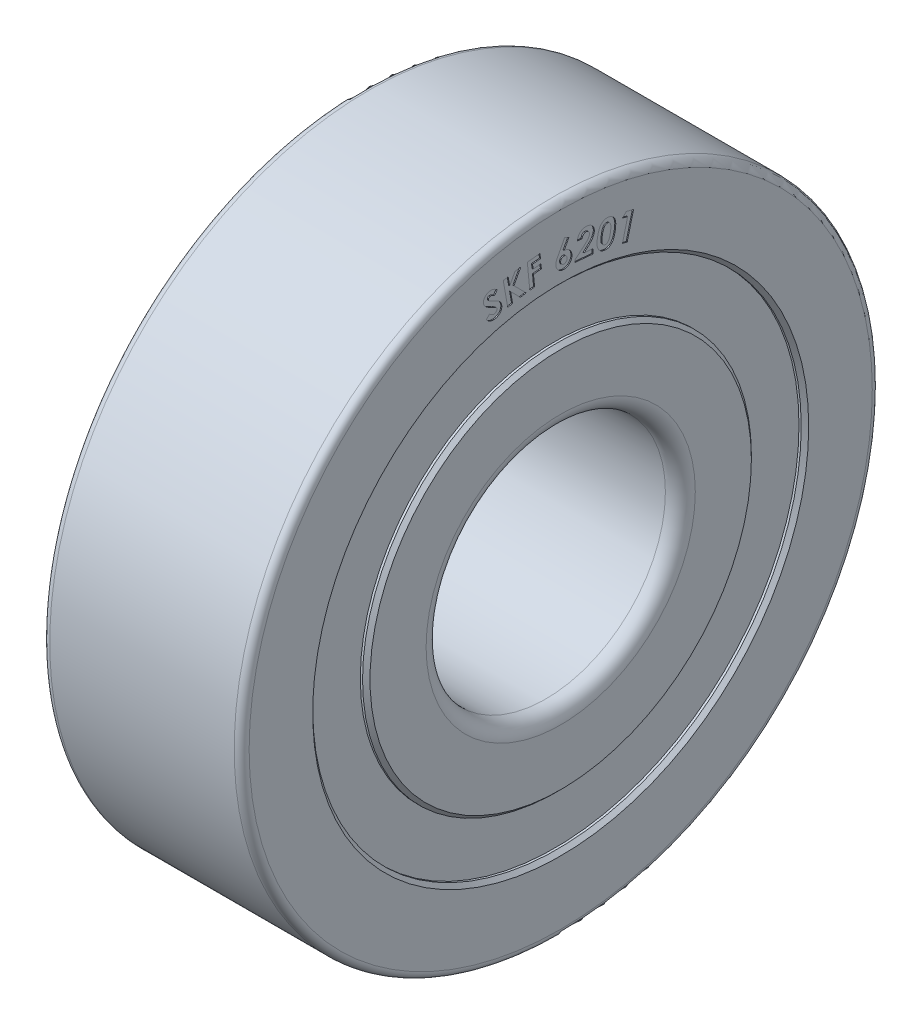
from build123d import *

# Parameters (mm, degrees)
CIRPATTERN1_COUNT = 8
WRAP1_START       = -0.05
WRAP1_DEPTH       = 0.05
SEAL_START        = 0.2
SKETCH5_R         = 12.25
SKETCH5_R_2       = 9.75
SEAL_1_DEPTH      = 0.2
SKETCH6_R         = 12.25
SKETCH6_R_2       = 9.75
SEAL_2_DEPTH      = 0.2


# Read off the part's stored shape, not the designer's step: Wrap1
with BuildPart() as part:
    # Sketch1 → Revolve1 (revolve)
    with BuildSketch(Plane.XY, mode=Mode.PRIVATE) as revolve1_sk:
        with BuildLine():
            Line((-9.8125, 9.75), (-7.165063509, 9.75))
            ThreePointArc((-7.165063509, 9.75), (-5, 8.5), (-2.834936491, 9.75))
            Line((-2.834936491, 9.75), (-0.1875, 9.75))
            Line((-0.1875, 9.75), (0, 9.5625))
            Line((0, 9.5625), (0, 6.75))
            ThreePointArc((0, 6.75), (-0.219669914, 6.219669914), (-0.75, 6))
            Line((-0.75, 6), (-9.25, 6))
            ThreePointArc((-9.25, 6), (-9.780330086, 6.219669914), (-10, 6.75))
            Line((-10, 6.75), (-10, 9.5625))
            Line((-10, 9.5625), (-9.8125, 9.75))
        make_face()
        with BuildLine():
            Line((-0.375, 16), (-9.625, 16))
            ThreePointArc((-9.625, 16), (-9.890165043, 15.890165043), (-10, 15.625))
            Line((-10, 15.625), (-10, 12.4375))
            Line((-10, 12.4375), (-9.8125, 12.25))
            Line((-9.8125, 12.25), (-7.165063509, 12.25))
            ThreePointArc((-7.165063509, 12.25), (-5, 13.5), (-2.834936491, 12.25))
            Line((-2.834936491, 12.25), (-0.1875, 12.25))
            Line((-0.1875, 12.25), (0, 12.4375))
            Line((0, 12.4375), (0, 15.625))
            ThreePointArc((0, 15.625), (-0.109834957, 15.890165043), (-0.375, 16))
        make_face()
    revolve(revolve1_sk.sketch.rotate(Axis((0, 0, 0), (-1, 0, 0)), 90), axis=Axis((0, 0, 0), (-1, 0, 0)))

    # Wrap1 outline → Wrap1 (cut)
    # profile 1 of 7: a face of its own
    with BuildSketch(Plane(origin=(0, 0, 0), x_dir=(0, 0, -1), z_dir=(1, 0, 0)).offset(WRAP1_START)):
        with BuildLine():
            add(Edge.make_bspline(
                [(2.737499951, 13.363276432), (2.733807226, 13.342852117), (2.7266215, 13.303108156), (2.71403937, 13.24554571), (2.700756131, 13.191683325), (2.685766048, 13.141789388), (2.670033097, 13.095556918), (2.652870722, 13.053145801), (2.634731994, 13.014472644), (2.615314136, 12.979556708), (2.594884118, 12.947916705), (2.573688946, 12.918935063), (2.552018473, 12.892188091), (2.528875899, 12.868579224), (2.5054133, 12.846955029), (2.481060944, 12.82799697), (2.455771096, 12.811643157), (2.429681485, 12.797886337), (2.402695227, 12.786155959), (2.374333105, 12.777487982), (2.345048041, 12.770563132), (2.314426594, 12.766554791), (2.282760862, 12.764405239), (2.249779656, 12.764767461), (2.215662951, 12.767294156), (2.192688918, 12.770843798), (2.180989534, 12.772651432)],
                knots=[0, 0, 0, 0, 0.067545985, 0.131438683, 0.191737407, 0.24805044, 0.300942885, 0.350625504, 0.396879519, 0.439879255, 0.480551384, 0.519373001, 0.556704184, 0.592468396, 0.626866328, 0.660490989, 0.692777508, 0.724752265, 0.756395798, 0.788384281, 0.821143235, 0.854225866, 0.888767365, 0.924366041, 0.961483874, 1, 1, 1, 1], degree=3))
            add(Edge.make_bspline(
                [(2.401822867, 14.106766015), (2.413140592, 14.104664027), (2.435517117, 14.100508139), (2.468014274, 14.091680855), (2.498782513, 14.08056972), (2.528172598, 14.068206349), (2.555899783, 14.053466776), (2.582157118, 14.036905537), (2.606737594, 14.018269945), (2.62981473, 13.997900292), (2.651131433, 13.975487993), (2.670804594, 13.95115389), (2.688536939, 13.924729428), (2.704452046, 13.896240433), (2.718449353, 13.865728371), (2.730749409, 13.833284075), (2.741105332, 13.798812129), (2.749809849, 13.762144315), (2.756206103, 13.72289735), (2.76077459, 13.68074346), (2.762286021, 13.635511443), (2.762084944, 13.587117471), (2.759402298, 13.535592916), (2.75427507, 13.480901048), (2.747443663, 13.423005152), (2.740877592, 13.383564851), (2.737499951, 13.363276432)],
                knots=[0, 0, 0, 0, 0.037292116, 0.073731071, 0.108963354, 0.143239421, 0.176961598, 0.21059567, 0.24373203, 0.276809835, 0.310235061, 0.343842068, 0.378091577, 0.413227158, 0.449474523, 0.486776185, 0.525574058, 0.566034139, 0.608809913, 0.654349649, 0.703334005, 0.755373739, 0.811140495, 0.870453047, 0.933359971, 1, 1, 1, 1], degree=3))
            add(Edge.make_bspline(
                [(2.038541617, 13.991401432), (2.051031324, 14.003350348), (2.075528547, 14.026786868), (2.116332601, 14.056004448), (2.158844885, 14.079785843), (2.203767876, 14.097118498), (2.250601106, 14.10857314), (2.299387367, 14.114291349), (2.350227913, 14.11414614), (2.384325847, 14.109268783), (2.401822867, 14.106766015)],
                knots=[0, 0, 0, 0, 0.130283265, 0.255536684, 0.377492833, 0.496937855, 0.617670735, 0.740347648, 0.866761943, 1, 1, 1, 1], degree=3))
            add(Edge.make_bspline(
                [(1.844270784, 13.503380599), (1.849374993, 13.531476455), (1.859218274, 13.585658297), (1.877959244, 13.66318627), (1.898121045, 13.734390857), (1.921291508, 13.79885056), (1.946684803, 13.8567636), (1.974637701, 13.907915468), (2.004199407, 13.953259349), (2.027363155, 13.978986103), (2.038541617, 13.991401432)],
                knots=[0, 0, 0, 0, 0.160881333, 0.310253829, 0.4492719, 0.577697131, 0.695952237, 0.805182789, 0.905984266, 1, 1, 1, 1], degree=3))
            add(Edge.make_bspline(
                [(2.180989534, 12.772651432), (2.169322819, 12.774838501), (2.14643497, 12.779129109), (2.113235778, 12.788134725), (2.081756779, 12.798643391), (2.052133652, 12.811311837), (2.024128155, 12.82550567), (1.998149886, 12.842041018), (1.973759648, 12.860015493), (1.951181286, 12.879882437), (1.930640585, 12.901932491), (1.91154269, 12.925613728), (1.894275762, 12.951355318), (1.878722092, 12.979005825), (1.864543023, 13.008516524), (1.852364105, 13.040064285), (1.842058411, 13.073521579), (1.832938308, 13.108993255), (1.826319414, 13.147219064), (1.82154004, 13.188419274), (1.819634097, 13.232963092), (1.820057726, 13.280747409), (1.822258321, 13.331855131), (1.827543595, 13.386100896), (1.834338661, 13.443736419), (1.840892271, 13.48309202), (1.844270784, 13.503380599)],
                knots=[0, 0, 0, 0, 0.038897413, 0.076309234, 0.112663958, 0.147600025, 0.181834877, 0.215467196, 0.24841971, 0.281078495, 0.313891878, 0.347089213, 0.380710697, 0.415371017, 0.451009272, 0.487947335, 0.526108121, 0.565723357, 0.607922782, 0.653174118, 0.701602887, 0.753962738, 0.809795306, 0.869230254, 0.932585652, 1, 1, 1, 1], degree=3))
        make_face()
        with BuildLine():
            add(Edge.make_bspline(
                [(2.084895784, 13.456766015), (2.081679204, 13.437433475), (2.075507334, 13.400338824), (2.069466538, 13.346607883), (2.065192946, 13.297378563), (2.064241313, 13.252422285), (2.065309572, 13.211708172), (2.06904795, 13.175274496), (2.075415994, 13.143114292), (2.084556355, 13.115174012), (2.096014628, 13.090891381), (2.10876045, 13.069378384), (2.123031841, 13.050428936), (2.13921613, 13.034416627), (2.156505557, 13.020673961), (2.175800795, 13.010215266), (2.196365939, 13.001869187), (2.211045191, 12.99889787), (2.218489534, 12.997391015)],
                knots=[0, 0, 0, 0, 0.110591194, 0.212198802, 0.305086177, 0.389376411, 0.465844276, 0.534826629, 0.595839759, 0.65052975, 0.700283282, 0.747083496, 0.791472616, 0.833737165, 0.875288639, 0.9156415, 0.957218961, 1, 1, 1, 1], degree=3))
            add(Edge.make_bspline(
                [(2.368749951, 13.876297265), (2.358693215, 13.877548717), (2.338923923, 13.88000879), (2.309192234, 13.877046211), (2.280324268, 13.86948998), (2.252265725, 13.856244757), (2.225336819, 13.836451621), (2.200440129, 13.808936509), (2.177908075, 13.773693846), (2.160158672, 13.73956586), (2.147209997, 13.707926157), (2.137254262, 13.680667824), (2.12763181, 13.650537791), (2.118727201, 13.617344266), (2.109403501, 13.581403146), (2.101055305, 13.542424967), (2.092596532, 13.500603182), (2.087520789, 13.471709083), (2.084895784, 13.456766015)],
                knots=[0, 0, 0, 0, 0.053786025, 0.105731283, 0.157836518, 0.211978457, 0.269819371, 0.334549736, 0.408221736, 0.491898867, 0.538912158, 0.590062543, 0.646309757, 0.707165765, 0.772934551, 0.843885536, 0.919262791, 1, 1, 1, 1], degree=3))
            add(Edge.make_bspline(
                [(2.496093701, 13.401818099), (2.499358181, 13.421849337), (2.505632803, 13.460351158), (2.512430928, 13.516034465), (2.516605471, 13.56720689), (2.518714514, 13.613866076), (2.517766153, 13.656074801), (2.514150545, 13.693662532), (2.508558552, 13.726859944), (2.499449007, 13.755536848), (2.488673967, 13.780739372), (2.476238882, 13.802808369), (2.462329401, 13.822279351), (2.446567644, 13.838637363), (2.429675962, 13.852786584), (2.410729239, 13.863507647), (2.390428505, 13.8717621), (2.376017025, 13.874776989), (2.368749951, 13.876297265)],
                knots=[0, 0, 0, 0, 0.111988795, 0.215252417, 0.309452219, 0.395261949, 0.472886488, 0.542190287, 0.60354385, 0.658237954, 0.707801833, 0.754561923, 0.797774535, 0.839449086, 0.879623806, 0.918897425, 0.959103546, 1, 1, 1, 1], degree=3))
            add(Edge.make_bspline(
                [(2.373177034, 13.060411849), (2.379873377, 13.068961755), (2.393947134, 13.086931159), (2.41227738, 13.118035424), (2.42930626, 13.153744546), (2.445157508, 13.19416969), (2.459976983, 13.23927911), (2.473324388, 13.289220782), (2.48560021, 13.343878828), (2.492504075, 13.381998165), (2.496093701, 13.401818099)],
                knots=[0, 0, 0, 0, 0.088795564, 0.186622326, 0.294646792, 0.412312407, 0.541704089, 0.683007715, 0.835181655, 1, 1, 1, 1], degree=3))
            add(Edge.make_bspline(
                [(2.218489534, 12.997391015), (2.225678742, 12.996414289), (2.239845163, 12.994489638), (2.261105847, 12.995011799), (2.281692967, 12.998767349), (2.301484053, 13.005289948), (2.320672378, 13.014645323), (2.339184487, 13.026934603), (2.35688135, 13.042405242), (2.36765254, 13.054307324), (2.373177034, 13.060411849)],
                knots=[0, 0, 0, 0, 0.123905972, 0.244158222, 0.361771315, 0.480512058, 0.599326979, 0.725697231, 0.859311352, 1, 1, 1, 1], degree=3))
        make_face(mode=Mode.SUBTRACT)
    # profile 2 of 7: a face of its own
    with BuildSketch(Plane(origin=(0, 0, 0), x_dir=(0, 0, -1), z_dir=(1, 0, 0)).offset(WRAP1_START)):
        with BuildLine():
            add(Edge.make_bspline(
                [(0.830735623, 13.851886561), (0.833432158, 13.86877561), (0.83869881, 13.901761922), (0.850709988, 13.949359484), (0.866156135, 13.993835878), (0.884529663, 14.035323297), (0.906235233, 14.073695236), (0.931449111, 14.108809808), (0.959803422, 14.140940657), (0.99146337, 14.169579516), (1.025472121, 14.194807508), (1.061586696, 14.216299856), (1.099555405, 14.233823542), (1.139238282, 14.247443729), (1.18080972, 14.256830229), (1.224063058, 14.262184308), (1.269222604, 14.263881306), (1.299753675, 14.261803549), (1.31537104, 14.260740727)],
                knots=[0, 0, 0, 0, 0.072277081, 0.141165699, 0.207200771, 0.271101887, 0.332731944, 0.393222883, 0.453533229, 0.513542499, 0.573359591, 0.632266994, 0.690883348, 0.749836455, 0.809303571, 0.870705961, 0.933863042, 1, 1, 1, 1], degree=3))
            Line((0.830735623, 13.851886561), (1.070579373, 13.830011561))
            add(Edge.make_bspline(
                [(1.27865229, 14.031834477), (1.272144447, 14.032221094), (1.259384441, 14.032979139), (1.240422759, 14.031945124), (1.222183745, 14.028793832), (1.204573643, 14.023768173), (1.187533329, 14.017079752), (1.171329401, 14.008017023), (1.155675305, 13.997362315), (1.140785188, 13.984850037), (1.127121854, 13.970525255), (1.114457251, 13.954885936), (1.10356845, 13.93761777), (1.094135487, 13.918931123), (1.086082937, 13.898791378), (1.079316141, 13.877216472), (1.074101456, 13.854121286), (1.07177409, 13.838189758), (1.070579373, 13.830011561)],
                knots=[0, 0, 0, 0, 0.060424494, 0.118475035, 0.175648187, 0.231711076, 0.288067957, 0.344991196, 0.403492114, 0.463480674, 0.524968313, 0.586823735, 0.649800494, 0.713884028, 0.780705219, 0.850723117, 0.923371087, 1, 1, 1, 1], degree=3))
            add(Edge.make_bspline(
                [(1.44037104, 13.843553227), (1.440940997, 13.855550988), (1.442048807, 13.878870735), (1.435593818, 13.913020701), (1.422292095, 13.944267852), (1.402864658, 13.972145952), (1.378410133, 13.996128285), (1.348894859, 14.014202906), (1.315301823, 14.026907006), (1.291176167, 14.030150662), (1.27865229, 14.031834477)],
                knots=[0, 0, 0, 0, 0.129257312, 0.251234202, 0.371268153, 0.493119118, 0.615659282, 0.7380741, 0.864031558, 1, 1, 1, 1], degree=3))
            add(Edge.make_bspline(
                [(1.163548123, 13.468032394), (1.176296035, 13.478798498), (1.200925216, 13.499598793), (1.235379273, 13.531085375), (1.267360906, 13.560285988), (1.295725202, 13.588388508), (1.320744882, 13.615114624), (1.343087218, 13.639909446), (1.361741805, 13.663636568), (1.382317032, 13.692245745), (1.402878227, 13.726566126), (1.421816228, 13.766735548), (1.435153676, 13.805403302), (1.438673659, 13.831141797), (1.44037104, 13.843553227)],
                knots=[0, 0, 0, 0, 0.104805719, 0.202486416, 0.293164386, 0.376836358, 0.453216447, 0.523135377, 0.586410623, 0.642700171, 0.744446816, 0.837146783, 0.921470102, 1, 1, 1, 1], degree=3))
            Line((1.163548123, 13.468032394), (0.726568957, 13.096417811))
            Line((0.726568957, 13.096417811), (0.715891873, 12.978709477))
            Line((0.715891873, 12.978709477), (1.61146479, 12.897459477))
            Line((1.61146479, 12.897459477), (1.632298123, 13.125063644))
            Line((1.632298123, 13.125063644), (1.17162104, 13.166990727))
            Line((1.17162104, 13.166990727), (1.330475207, 13.306574061))
            add(Edge.make_bspline(
                [(1.68646479, 13.840428227), (1.685383952, 13.830773238), (1.683190954, 13.811183457), (1.677336533, 13.781787991), (1.669497501, 13.752051626), (1.659583438, 13.721922959), (1.647205753, 13.691615186), (1.633190875, 13.660649331), (1.616656727, 13.629596603), (1.598375277, 13.597700399), (1.577147956, 13.565151811), (1.552184986, 13.531893066), (1.524026898, 13.497165524), (1.492153567, 13.461267421), (1.456782638, 13.42411253), (1.417822156, 13.385876564), (1.375719932, 13.346162332), (1.345840787, 13.320018651), (1.330475207, 13.306574061)],
                knots=[0, 0, 0, 0, 0.044322816, 0.089930112, 0.136630675, 0.184612579, 0.234564071, 0.285974149, 0.339667434, 0.395047136, 0.453723857, 0.516873516, 0.58474752, 0.657719536, 0.73590087, 0.818821739, 0.906827682, 1, 1, 1, 1], degree=3))
            add(Edge.make_bspline(
                [(1.31537104, 14.260740727), (1.334369722, 14.258402659), (1.371480977, 14.253835572), (1.42479907, 14.239715674), (1.473916081, 14.219181303), (1.518997371, 14.193093309), (1.559526074, 14.161417243), (1.595392531, 14.124682089), (1.625783331, 14.082455249), (1.650656562, 14.036039894), (1.66966029, 13.987353834), (1.682816278, 13.938238103), (1.688913479, 13.88908168), (1.687277747, 13.856581024), (1.68646479, 13.840428227)],
                knots=[0, 0, 0, 0, 0.091940725, 0.179593287, 0.264139606, 0.347159484, 0.429211051, 0.510655585, 0.593119915, 0.678441152, 0.763135621, 0.843800373, 0.922368925, 1, 1, 1, 1], degree=3))
        make_face()
    # profile 3 of 7: a face of its own
    with BuildSketch(Plane(origin=(0, 0, 0), x_dir=(0, 0, -1), z_dir=(1, 0, 0)).offset(WRAP1_START)):
        with BuildLine():
            add(Edge.make_bspline(
                [(0.173468268, 13.770517026), (0.186947038, 13.770012521), (0.213428443, 13.769021331), (0.25232208, 13.762793717), (0.289620721, 13.753289262), (0.325359617, 13.739802548), (0.359539414, 13.722907717), (0.392130884, 13.702153727), (0.422785051, 13.677463569), (0.451899581, 13.649831608), (0.478130242, 13.619254234), (0.501640752, 13.586991439), (0.520875217, 13.55251183), (0.536951774, 13.516600028), (0.548855496, 13.47871113), (0.557496989, 13.439250824), (0.562559771, 13.397907938), (0.562885668, 13.369749775), (0.563051601, 13.35541286)],
                knots=[0, 0, 0, 0, 0.063712171, 0.125173721, 0.185786933, 0.245390216, 0.305400352, 0.365733716, 0.4276416, 0.491204266, 0.555209138, 0.617843092, 0.679583468, 0.741498151, 0.80353103, 0.866957115, 0.932260329, 1, 1, 1, 1], degree=3))
            Line((0.173468268, 13.770517026), (0.404718268, 14.207496193))
            Line((0.404718268, 14.207496193), (0.196905768, 14.31478786))
            Line((0.196905768, 14.31478786), (-0.143198399, 13.668173276))
            add(Edge.make_bspline(
                [(-0.248146316, 13.362704526), (-0.247768073, 13.372697275), (-0.247009313, 13.392742875), (-0.243259496, 13.422865854), (-0.237322575, 13.452996331), (-0.230208902, 13.478352996), (-0.223002473, 13.499733866), (-0.215902449, 13.517828983), (-0.207554303, 13.538004414), (-0.197605883, 13.560124944), (-0.186138331, 13.584344667), (-0.173110091, 13.610516636), (-0.158775675, 13.63876961), (-0.148524426, 13.658119868), (-0.143198399, 13.668173276)],
                knots=[0, 0, 0, 0, 0.091871355, 0.184295283, 0.278641223, 0.373873502, 0.426097173, 0.485953161, 0.552477122, 0.626757907, 0.708837919, 0.798748528, 0.895439984, 1, 1, 1, 1], degree=3))
            add(Edge.make_bspline(
                [(0.154718268, 12.95697536), (0.140457516, 12.95746398), (0.112321028, 12.958428028), (0.071174508, 12.964901612), (0.031838733, 12.974641878), (-0.005491297, 12.988657718), (-0.04094757, 13.006348542), (-0.074479371, 13.027922196), (-0.106223821, 13.05305327), (-0.135482189, 13.081786206), (-0.162218678, 13.112760612), (-0.185292373, 13.145448088), (-0.205489094, 13.178818797), (-0.221241519, 13.213604246), (-0.23374624, 13.249306454), (-0.242141114, 13.286178572), (-0.247731896, 13.324076833), (-0.248007334, 13.349750104), (-0.248146316, 13.362704526)],
                knots=[0, 0, 0, 0, 0.06734365, 0.132869139, 0.196314253, 0.258459609, 0.320803476, 0.383131162, 0.446460908, 0.511699705, 0.576540449, 0.639456057, 0.700491865, 0.760485912, 0.819483933, 0.878858307, 0.938873366, 1, 1, 1, 1], degree=3))
            add(Edge.make_bspline(
                [(0.563051601, 13.35541286), (0.562535737, 13.341590464), (0.561521903, 13.314425143), (0.555462, 13.274514485), (0.545406987, 13.236394629), (0.532233373, 13.199614539), (0.514865109, 13.164741419), (0.494189314, 13.131307061), (0.469579855, 13.099782935), (0.441576869, 13.070328124), (0.411150534, 13.043502113), (0.378986413, 13.019813298), (0.345262072, 13.000025765), (0.310140778, 12.983543065), (0.273238881, 12.971540068), (0.235043749, 12.962471262), (0.195303743, 12.95750483), (0.16835956, 12.957153321), (0.154718268, 12.95697536)],
                knots=[0, 0, 0, 0, 0.065324149, 0.128382331, 0.190264872, 0.251382752, 0.31265323, 0.374003292, 0.436853007, 0.501266752, 0.565784895, 0.628301772, 0.689716249, 0.75027965, 0.811244551, 0.872734322, 0.935567973, 1, 1, 1, 1], degree=3))
        make_face()
        with BuildLine():
            add(Edge.make_bspline(
                [(-0.007260899, 13.366089943), (-0.006876546, 13.354050164), (-0.006126977, 13.3305701), (0.003144181, 13.296866168), (0.018200648, 13.266075987), (0.039006202, 13.238924092), (0.063866269, 13.216502718), (0.091577609, 13.19981003), (0.121630881, 13.189429993), (0.142572492, 13.187937802), (0.153155768, 13.187183693)],
                knots=[0, 0, 0, 0, 0.135186379, 0.263641458, 0.389922987, 0.518897229, 0.646206449, 0.764506131, 0.880988305, 1, 1, 1, 1], degree=3))
            add(Edge.make_bspline(
                [(0.156801601, 13.537964943), (0.145703638, 13.537609195), (0.124050264, 13.536915089), (0.093120765, 13.527188518), (0.064882305, 13.511825464), (0.040079774, 13.490434732), (0.019459521, 13.4643606), (0.004105738, 13.434519072), (-0.005238525, 13.401270392), (-0.006573779, 13.378042815), (-0.007260899, 13.366089943)],
                knots=[0, 0, 0, 0, 0.125199432, 0.244278191, 0.363027997, 0.487107669, 0.61235338, 0.737181965, 0.864754278, 1, 1, 1, 1], degree=3))
            add(Edge.make_bspline(
                [(0.322166184, 13.361923276), (0.321726626, 13.373947677), (0.320874075, 13.397269788), (0.312483928, 13.430915557), (0.297219106, 13.46106719), (0.276584066, 13.487528791), (0.251777339, 13.509916902), (0.222820029, 13.525967311), (0.190791567, 13.536085152), (0.168336358, 13.537327021), (0.156801601, 13.537964943)],
                knots=[0, 0, 0, 0, 0.133531098, 0.258992296, 0.381998195, 0.506509268, 0.63025499, 0.750801937, 0.871992319, 1, 1, 1, 1], degree=3))
            add(Edge.make_bspline(
                [(0.153155768, 13.187183693), (0.164238792, 13.187695742), (0.185998399, 13.188701063), (0.217518661, 13.197860797), (0.246384663, 13.213674136), (0.272261964, 13.235273054), (0.294058044, 13.261607952), (0.310385244, 13.291974897), (0.320246306, 13.325907698), (0.321514857, 13.349704832), (0.322166184, 13.361923276)],
                knots=[0, 0, 0, 0, 0.122637376, 0.24077734, 0.360016813, 0.485042179, 0.612163467, 0.736550565, 0.864734041, 1, 1, 1, 1], degree=3))
        make_face(mode=Mode.SUBTRACT)
    # profile 4 of 7: a face of its own
    with BuildSketch(Plane(origin=(0, 0, 0), x_dir=(0, 0, -1), z_dir=(1, 0, 0)).offset(WRAP1_START)):
        with BuildLine():
            add(Edge.make_bspline(
                [(-3.321157352, 13.551873315), (-3.331450009, 13.560198687), (-3.351181298, 13.57615864), (-3.38162082, 13.596549774), (-3.41089479, 13.613217941), (-3.439527565, 13.62529098), (-3.467104851, 13.633577042), (-3.493805887, 13.637992172), (-3.519816334, 13.63785699), (-3.536382717, 13.634518048), (-3.544594852, 13.632862898)],
                knots=[0, 0, 0, 0, 0.160969074, 0.308581882, 0.44520165, 0.570135247, 0.685746178, 0.79477476, 0.898267633, 1, 1, 1, 1], degree=3))
            Line((-3.321157352, 13.551873315), (-3.184699019, 13.753956648))
            add(Edge.make_bspline(
                [(-3.600324019, 13.862550398), (-3.584678156, 13.866068926), (-3.553556646, 13.873067702), (-3.505728135, 13.876557193), (-3.457753347, 13.874107813), (-3.417649354, 13.867429895), (-3.385076626, 13.858720018), (-3.359396802, 13.850170582), (-3.332706706, 13.839276114), (-3.304851559, 13.826682724), (-3.276309413, 13.811315491), (-3.246451535, 13.794473186), (-3.215789235, 13.77512317), (-3.195246902, 13.76113775), (-3.184699019, 13.753956648)],
                knots=[0, 0, 0, 0, 0.108047546, 0.214919614, 0.322191863, 0.431438326, 0.488386557, 0.549484368, 0.613847185, 0.682749942, 0.755556858, 0.832388639, 0.913936501, 1, 1, 1, 1], degree=3))
            add(Edge.make_bspline(
                [(-3.863344852, 13.455519148), (-3.86583411, 13.466328725), (-3.870734827, 13.487610041), (-3.874001735, 13.519930609), (-3.874175587, 13.551896643), (-3.870308554, 13.583459197), (-3.863673609, 13.614789553), (-3.85295031, 13.645536732), (-3.839529318, 13.676218068), (-3.82224258, 13.705888327), (-3.802571998, 13.734276625), (-3.780176338, 13.760225122), (-3.7558373, 13.783829997), (-3.729289239, 13.805080468), (-3.700098292, 13.823216311), (-3.668993928, 13.839249361), (-3.635586939, 13.85260127), (-3.612197009, 13.859200537), (-3.600324019, 13.862550398)],
                knots=[0, 0, 0, 0, 0.061637042, 0.121347718, 0.180244897, 0.239049011, 0.297853125, 0.358003242, 0.419813973, 0.483825244, 0.548646954, 0.611639763, 0.674118049, 0.736997913, 0.800350426, 0.864907332, 0.931425451, 1, 1, 1, 1], degree=3))
            add(Edge.make_bspline(
                [(-3.424803186, 13.099529565), (-3.444733022, 13.108710603), (-3.482963776, 13.126322289), (-3.537164889, 13.153369231), (-3.586480588, 13.178658902), (-3.630486031, 13.203255791), (-3.669567329, 13.226165485), (-3.703284756, 13.248179707), (-3.732145602, 13.26852263), (-3.756048009, 13.288431745), (-3.776432255, 13.308070335), (-3.794543987, 13.327701776), (-3.810888478, 13.347778469), (-3.824840261, 13.368529241), (-3.837596876, 13.389398556), (-3.8481826, 13.410936079), (-3.856940695, 13.432965922), (-3.861213339, 13.448012695), (-3.863344852, 13.455519148)],
                knots=[0, 0, 0, 0, 0.112775619, 0.216333786, 0.311321554, 0.397602949, 0.475421926, 0.544104326, 0.604528439, 0.656798734, 0.703816074, 0.7499163, 0.794023829, 0.836718668, 0.878344049, 0.91964777, 0.959914311, 1, 1, 1, 1], degree=3))
            add(Edge.make_bspline(
                [(-3.197980269, 12.927394148), (-3.20024207, 12.934447318), (-3.204838073, 12.948779434), (-3.21684138, 12.968861002), (-3.232537689, 12.987822667), (-3.24883864, 13.002616267), (-3.264511092, 13.014548746), (-3.279396788, 13.024295551), (-3.296904723, 13.03503888), (-3.317214329, 13.046371085), (-3.340187688, 13.05867963), (-3.365945569, 13.071587415), (-3.39438281, 13.085469908), (-3.414368319, 13.094706789), (-3.424803186, 13.099529565)],
                knots=[0, 0, 0, 0, 0.075530719, 0.153479235, 0.237352926, 0.32655707, 0.377862412, 0.438668858, 0.50839039, 0.587880213, 0.676432819, 0.774878021, 0.882458938, 1, 1, 1, 1], degree=3))
            add(Edge.make_bspline(
                [(-3.312563602, 12.770883732), (-3.302798084, 12.773850581), (-3.283759025, 12.779634811), (-3.258016842, 12.7936637), (-3.235819404, 12.811378852), (-3.218123614, 12.83273606), (-3.204511239, 12.85572362), (-3.196426588, 12.879751257), (-3.193686325, 12.903975663), (-3.196552349, 12.919606499), (-3.197980269, 12.927394148)],
                knots=[0, 0, 0, 0, 0.142448758, 0.277721077, 0.407231143, 0.537348747, 0.663549761, 0.77873367, 0.889759912, 1, 1, 1, 1], degree=3))
            add(Edge.make_bspline(
                [(-3.564126102, 12.883644148), (-3.553307211, 12.872401452), (-3.532569846, 12.85085175), (-3.499540769, 12.823363833), (-3.467592654, 12.800375002), (-3.435517047, 12.783623753), (-3.404071275, 12.771757775), (-3.372939726, 12.765656834), (-3.342159983, 12.764765365), (-3.322416424, 12.768846889), (-3.312563602, 12.770883732)],
                knots=[0, 0, 0, 0, 0.16155371, 0.309661872, 0.444660892, 0.568582295, 0.683548733, 0.791686455, 0.896043254, 1, 1, 1, 1], degree=3))
            Line((-3.564126102, 12.883644148), (-3.733396936, 12.710467065))
            add(Edge.make_bspline(
                [(-3.258917769, 12.542498315), (-3.269996818, 12.539823316), (-3.291845396, 12.534548049), (-3.324671086, 12.529472514), (-3.356943074, 12.526359123), (-3.38862215, 12.526407237), (-3.419806804, 12.527649438), (-3.450357187, 12.531974406), (-3.480403003, 12.538455191), (-3.509901352, 12.547386804), (-3.539090936, 12.558557716), (-3.567659529, 12.572828378), (-3.596184087, 12.589224804), (-3.624337971, 12.608341697), (-3.652225354, 12.630035391), (-3.679836582, 12.654249018), (-3.706999671, 12.681254558), (-3.72445813, 12.700574945), (-3.733396936, 12.710467065)],
                knots=[0, 0, 0, 0, 0.063976005, 0.126164686, 0.18636135, 0.245833265, 0.303914493, 0.361477936, 0.418844969, 0.476367118, 0.534393091, 0.594126133, 0.655495569, 0.719039274, 0.785049844, 0.853788384, 0.925139031, 1, 1, 1, 1], degree=3))
            add(Edge.make_bspline(
                [(-2.965688602, 12.998487898), (-2.962758127, 12.985772516), (-2.956999256, 12.960784673), (-2.95259998, 12.92317716), (-2.951987818, 12.886345757), (-2.955413233, 12.8503816), (-2.962505703, 12.815218758), (-2.97318706, 12.780855812), (-2.987977398, 12.747437278), (-3.006064227, 12.714994149), (-3.02762953, 12.684368255), (-3.052216828, 12.656068138), (-3.079712828, 12.630529316), (-3.109868632, 12.607340622), (-3.143062516, 12.587153467), (-3.179010481, 12.569303881), (-3.217817996, 12.554191867), (-3.245045317, 12.546445253), (-3.258917769, 12.542498315)],
                knots=[0, 0, 0, 0, 0.064349515, 0.12645751, 0.186429967, 0.24580134, 0.304351226, 0.363146579, 0.422990413, 0.484355462, 0.546149538, 0.607477203, 0.668997523, 0.73102275, 0.794861314, 0.860373556, 0.92885965, 1, 1, 1, 1], degree=3))
            add(Edge.make_bspline(
                [(-3.172980269, 13.251092065), (-3.158483546, 13.242145325), (-3.130695678, 13.224995874), (-3.093466978, 13.196279519), (-3.060971531, 13.167816494), (-3.033984995, 13.137938573), (-3.011399877, 13.10651511), (-2.992265635, 13.073092678), (-2.976739211, 13.03689364), (-2.969411376, 13.011426181), (-2.965688602, 12.998487898)],
                knots=[0, 0, 0, 0, 0.151908413, 0.291183806, 0.419000442, 0.536913709, 0.649559886, 0.763698201, 0.87995114, 1, 1, 1, 1], degree=3))
            add(Edge.make_bspline(
                [(-3.376365686, 13.352654565), (-3.363179004, 13.346301672), (-3.338204383, 13.334269752), (-3.302583464, 13.31741211), (-3.271166438, 13.301942417), (-3.243506835, 13.288597538), (-3.220215238, 13.276500451), (-3.200741945, 13.26665479), (-3.18544296, 13.258430076), (-3.176701118, 13.253282895), (-3.172980269, 13.251092065)],
                knots=[0, 0, 0, 0, 0.193115473, 0.365746736, 0.519919902, 0.655138714, 0.770895423, 0.866165996, 0.943035331, 1, 1, 1, 1], degree=3))
            add(Edge.make_bspline(
                [(-3.593292769, 13.468800398), (-3.589324754, 13.465985214), (-3.580170014, 13.459490207), (-3.563859237, 13.449422222), (-3.543332115, 13.43743151), (-3.518266747, 13.424066209), (-3.489060541, 13.408610426), (-3.455431551, 13.391485983), (-3.417475201, 13.372427545), (-3.390535684, 13.359470094), (-3.376365686, 13.352654565)],
                knots=[0, 0, 0, 0, 0.059250717, 0.13669933, 0.233360931, 0.348803747, 0.482656653, 0.635873813, 0.808472165, 1, 1, 1, 1], degree=3))
            add(Edge.make_bspline(
                [(-3.630271936, 13.523227482), (-3.628647837, 13.518020232), (-3.625408985, 13.507635691), (-3.616921304, 13.493474165), (-3.606484118, 13.480140973), (-3.597775884, 13.472654523), (-3.593292769, 13.468800398)],
                knots=[0, 0, 0, 0, 0.243809625, 0.48621651, 0.735497396, 1, 1, 1, 1], degree=3))
            add(Edge.make_bspline(
                [(-3.544594852, 13.632862898), (-3.551991441, 13.630698534), (-3.566301859, 13.626511067), (-3.585444756, 13.616049576), (-3.602099379, 13.603486116), (-3.615144209, 13.588228015), (-3.624703007, 13.571898276), (-3.631097578, 13.555597888), (-3.633177017, 13.539047981), (-3.631240937, 13.528504471), (-3.630271936, 13.523227482)],
                knots=[0, 0, 0, 0, 0.150120548, 0.290443074, 0.423381042, 0.555603528, 0.679475027, 0.791592124, 0.895692617, 1, 1, 1, 1], degree=3))
        make_face()
    # profile 5 of 7: a face of its own
    with BuildSketch(Plane(origin=(0, 0, 0), x_dir=(0, 0, -1), z_dir=(1, 0, 0)).offset(WRAP1_START)):
        Polygon((3.335113879, 12.556611416), (3.650738879, 13.813642666), (3.292665963, 13.903486416), (3.097874296, 13.713642666), (3.356728463, 13.648538499), (3.097353463, 12.616246833), align=None)
    # profile 6 of 7: a face of its own
    with BuildSketch(Plane(origin=(0, 0, 0), x_dir=(0, 0, -1), z_dir=(1, 0, 0)).offset(WRAP1_START)):
        Polygon((-1.016316546, 14.008759864), (-1.039493629, 14.246520281), (-1.675170712, 14.184020281), (-1.549649879, 12.903030697), (-1.308504046, 12.926728614), (-1.365014462, 13.503291114), (-0.970483212, 13.542093197), (-0.993399879, 13.776207781), (-1.387931129, 13.737405697), (-1.410847796, 13.969957781), align=None)
    # profile 7 of 7: a face of its own
    with BuildSketch(Plane(origin=(0, 0, 0), x_dir=(0, 0, -1), z_dir=(1, 0, 0)).offset(WRAP1_START)):
        Polygon((-2.559540857, 13.595659563), (-2.636363774, 14.032117897), (-2.880634607, 13.98888873), (-2.656936691, 12.719878313), (-2.412665857, 12.76310748), (-2.511884607, 13.32638873), (-2.021259607, 12.832117897), (-1.734801274, 12.88263873), (-2.345217941, 13.49982623), (-2.001467941, 14.144097063), (-2.292353357, 14.09279498), align=None)
    extrude(amount=WRAP1_DEPTH, mode=Mode.SUBTRACT)


with BuildPart() as body_2:
    # Sketch2 → Revolve2 (revolve)
    with BuildSketch(Plane.XY):
        with BuildLine():
            Line((-5, 13.5), (-5, 8.5))
            ThreePointArc((-5, 8.5), (-2.5, 11), (-5, 13.5))
        make_face()
    revolve(axis=Axis((-5, 13.5, 0), (0, -1, 0)))


with BuildPart() as cirpattern1_1:
    # CirPattern1: pattern copy
    add(body_2.part.rotate(Axis((0, 0, 0), (1, 0, 0)), 1 * 360 / CIRPATTERN1_COUNT))


with BuildPart() as cirpattern1_2:
    # CirPattern1: pattern copy
    add(body_2.part.rotate(Axis((0, 0, 0), (1, 0, 0)), 2 * 360 / CIRPATTERN1_COUNT))


with BuildPart() as cirpattern1_3:
    # CirPattern1: pattern copy
    add(body_2.part.rotate(Axis((0, 0, 0), (1, 0, 0)), 3 * 360 / CIRPATTERN1_COUNT))


with BuildPart() as cirpattern1_4:
    # CirPattern1: pattern copy
    add(body_2.part.rotate(Axis((0, 0, 0), (1, 0, 0)), 4 * 360 / CIRPATTERN1_COUNT))


with BuildPart() as cirpattern1_5:
    # CirPattern1: pattern copy
    add(body_2.part.rotate(Axis((0, 0, 0), (1, 0, 0)), 5 * 360 / CIRPATTERN1_COUNT))


with BuildPart() as cirpattern1_6:
    # CirPattern1: pattern copy
    add(body_2.part.rotate(Axis((0, 0, 0), (1, 0, 0)), 6 * 360 / CIRPATTERN1_COUNT))


with BuildPart() as cirpattern1_7:
    # CirPattern1: pattern copy
    add(body_2.part.rotate(Axis((0, 0, 0), (1, 0, 0)), 7 * 360 / CIRPATTERN1_COUNT))


with BuildPart() as body_10:
    # Sketch5 → Seal 1 (new body)
    with BuildSketch(Plane(origin=(-0.5, 0, 0), x_dir=(0, 0, -1), z_dir=(1, 0, 0)).offset(SEAL_START)):
        Circle(SKETCH5_R)
        Circle(SKETCH5_R_2, mode=Mode.SUBTRACT)
    extrude(amount=-SEAL_1_DEPTH)


with BuildPart() as body_11:
    # Sketch6 → Seal 2 (new body)
    with BuildSketch(Plane.ZY.offset(9.5)):
        Circle(SKETCH6_R)
        Circle(SKETCH6_R_2, mode=Mode.SUBTRACT)
    extrude(amount=SEAL_2_DEPTH)


solid = Compound([part.part, body_2.part, cirpattern1_1.part, cirpattern1_2.part, cirpattern1_3.part, cirpattern1_4.part, cirpattern1_5.part, cirpattern1_6.part, cirpattern1_7.part, body_10.part, body_11.part])
